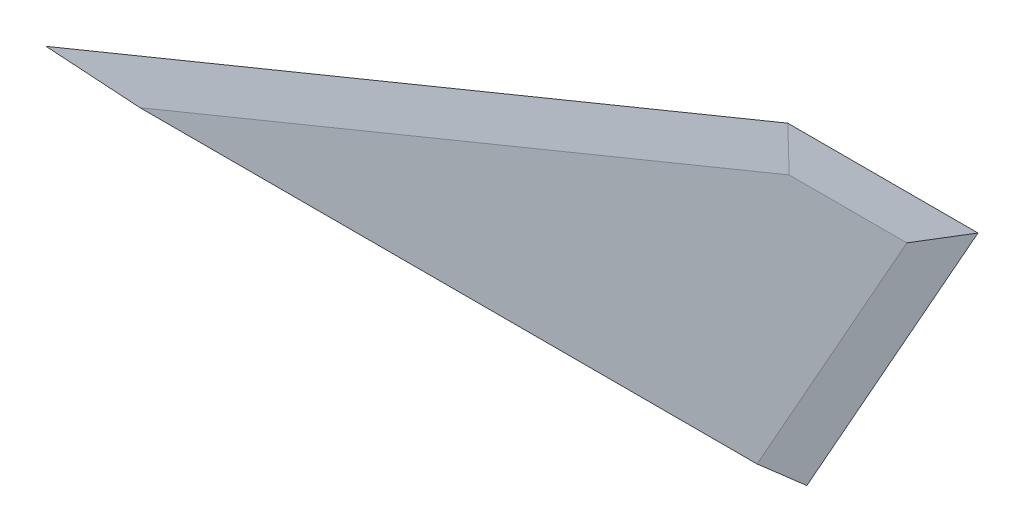
from build123d import *
from OCP.BRepFilletAPI import BRepFilletAPI_MakeChamfer

# Parameters (mm, degrees)
BOSS_EXTRUDE1_DEPTH = 3.18
CHAMFER1_SIZE       = 1.59
CHAMFER1_SIZE2      = 10
CHAMFER2_SIZE       = 10
CHAMFER2_SIZE_2     = 1.59
SKETCH2_R           = 41
CUT_EXTRUDE1_DEPTH  = 200


with BuildPart() as part:
    # Sketch1 → Boss-Extrude1 (new body)
    with BuildSketch(Plane.XY):
        Polygon((0, 0), (200, 0), (245, 80.01), (195, 80.01), align=None)
    extrude(amount=BOSS_EXTRUDE1_DEPTH)

    # Chamfer1: one chamfer whose edges measure the first distance from different faces: ONE call of the kernel's chamfer builder (chamfer() names one face for all edges)
    chamfer1_edges_1 = [part.edges().sort_by_distance(p)[0] for p in [
        (222.5, 40.005, 3.18),
    ]]
    chamfer1_side_1 = [part.faces().sort_by_distance(p)[0] for p in [
        (222.5, 40.005, 1.59),
    ]]
    chamfer1_edges_2 = [part.edges().sort_by_distance(p)[0] for p in [
        (220, 80.01, 3.18),
    ]]
    chamfer1_side_2 = [part.faces().sort_by_distance(p)[0] for p in [
        (220, 80.01, 1.59),
    ]]
    chamfer1_edges_3 = [part.edges().sort_by_distance(p)[0] for p in [
        (97.5, 40.005, 3.18),
    ]]
    chamfer1_side_3 = [part.faces().sort_by_distance(p)[0] for p in [
        (97.5, 40.005, 1.59),
    ]]
    chamfer1 = BRepFilletAPI_MakeChamfer(part.part.solid().wrapped)
    for e in chamfer1_edges_1:
        chamfer1.Add(CHAMFER1_SIZE, CHAMFER1_SIZE2, e.wrapped, chamfer1_side_1[0].wrapped)  # the first distance lies on this face
    for e in chamfer1_edges_2:
        chamfer1.Add(CHAMFER1_SIZE, CHAMFER1_SIZE2, e.wrapped, chamfer1_side_2[0].wrapped)  # the first distance lies on this face
    for e in chamfer1_edges_3:
        chamfer1.Add(CHAMFER1_SIZE, CHAMFER1_SIZE2, e.wrapped, chamfer1_side_3[0].wrapped)  # the first distance lies on this face
    add(Compound.cast(chamfer1.Shape()), mode=Mode.REPLACE)

    # Chamfer2
    # the kernel refuses this chamfer: 10, 1.59 mm, written as the material it takes off along each edge
    with BuildSketch(Plane(origin=(187.260266978, -22.651245312, 0), x_dir=(-0.8715858085324353, 0.49020574158179714, -0.006042291378384645), z_dir=(0.4902146903574218, 0.8716017194554959, 0))) as chamfer2_piece_1:
        Polygon((CHAMFER2_SIZE * 0.999981745191, CHAMFER2_SIZE * 0.00604229137838), (-CHAMFER2_SIZE_2 * 0.00604229137837, CHAMFER2_SIZE_2 * 0.999981745191), (0, 0), align=None)
    extrude(amount=143.772651921, mode=Mode.SUBTRACT)
    with BuildSketch(Plane(origin=(219.042912573, 89.874991974, 0), x_dir=(-0.0882418861116751, 0.21506271455788833, 0.9726054690070617), z_dir=(-0.9251519574595215, -0.3795969646991606, 0))) as chamfer2_piece_2:
        Polygon((CHAMFER2_SIZE_2 * 0.972605469007, -CHAMFER2_SIZE_2 * 0.232462043477), (-CHAMFER2_SIZE * 0.232462043477, -CHAMFER2_SIZE * 0.972605469007), (0, 0), align=None)
    extrude(amount=262.752322131, mode=Mode.SUBTRACT)
    with BuildSketch(Plane(origin=(270.98806864, 80.01, 0), x_dir=(0, -0.9999817451908304, -0.006042291378384625), z_dir=(-1, 0, 0))) as chamfer2_piece_3:
        Polygon((CHAMFER2_SIZE * 0.999981745191, CHAMFER2_SIZE * 0.00604229137838), (-CHAMFER2_SIZE_2 * 0.00604229137838, CHAMFER2_SIZE_2 * 0.999981745191), (0, 0), align=None)
    extrude(amount=101.976137281, mode=Mode.SUBTRACT)

    # Sketch2 → Cut-Extrude1 (cut)
    with BuildSketch(Plane(origin=(0, 0, 0), x_dir=(0, 0, -1), z_dir=(1, 0, 0))):
        with Locations((-1.59, -40.969157912)):
            Circle(SKETCH2_R)
    extrude(amount=CUT_EXTRUDE1_DEPTH, mode=Mode.SUBTRACT)


solid = part.part
